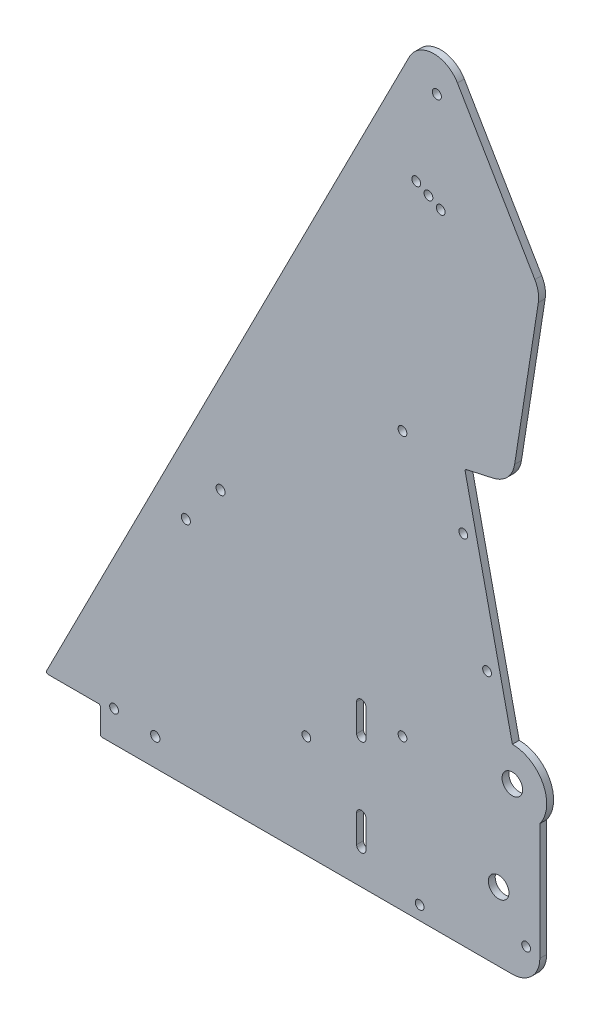
from build123d import *

# Parameters (mm, degrees)
BOSS_EXTRUDE1_DEPTH = 3.175
SKETCH2_R           = 2.0955
SKETCH2_R_2         = 2.032
SKETCH2_R_3         = 4.7625
CUT_EXTRUDE1_DEPTH  = 421.976111717
SKETCH7_R           = 2.159
CUT_EXTRUDE2_DEPTH  = 421.976111717
CUT_EXTRUDE3_REACH  = 422.976
SKETCH10_R          = 2.032
FILLET1_R           = 12.7
FILLET2_R           = 0.79375
SKETCH12_R          = 2.032
CUT_EXTRUDE5_DEPTH  = 410.593447353


with BuildPart() as part:
    # Sketch1 → Boss-Extrude1 (new body)
    with BuildSketch(Plane.XY):
        with BuildLine():
            Line((228.6, -12.7), (228.6, 53.975))
            ThreePointArc((228.6, 53.975), (230.099031657, 70.599515829), (215.9, 79.375))
            Line((215.9, 79.375), (193.909735224, 178.566674323))
            Line((193.909735224, 178.566674323), (215.607913982, 183.377044743))
            Line((215.607913982, 183.377044743), (228.6, 266.7))
            Line((228.6, 266.7), (178.754725958, 351.413083686))
            Line((178.754725958, 351.413083686), (0, 0))
            Line((0, 0), (25.4, 0))
            Line((25.4, 0), (25.4, -12.7))
            Line((25.4, -12.7), (228.6, -12.7))
        make_face()
    extrude(amount=BOSS_EXTRUDE1_DEPTH)

    # Sketch2 → Cut-Extrude1 (cut, through all)
    with BuildSketch(Plane.XY.offset(3.175)):
        with Locations((64.943150167, 94.057839899)):
            Circle(SKETCH2_R)
        with Locations((180.975, 322.164313376)):
            Circle(SKETCH2_R)
        with Locations((81.00705334, 113.73297687)):
            Circle(SKETCH2_R)
        with Locations((193.207821773, 152.394364194)):
            Circle(SKETCH2_R_2)
        with Locations((215.9, 63.5)):
            Circle(SKETCH2_R_3)
        with Locations((173.0375, -6.35)):
            Circle(SKETCH2_R_2)
        with Locations((204.202954161, 102.798527032)):
            Circle(SKETCH2_R_2)
        with Locations((209.55, 19.05)):
            Circle(SKETCH2_R_3)
        with Locations((165.1, 179.3875)):
            Circle(SKETCH2_R_2)
        with Locations((182.769678626, 276.816972924)):
            Circle(SKETCH2_R_2)
        with Locations((177.109839313, 279.695986462)):
            Circle(SKETCH2_R_2)
        with Locations((171.45, 282.575)):
            Circle(SKETCH2_R_2)
    extrude(amount=-CUT_EXTRUDE1_DEPTH, mode=Mode.SUBTRACT)

    # Sketch7 → Cut-Extrude2 (cut, through all)
    with BuildSketch(Plane.XY.offset(3.175)):
        with Locations((50.8, 0)):
            Circle(SKETCH7_R)
        with BuildLine():
            Line((143.891, 3.175), (143.891, 15.875))
            ThreePointArc((143.891, 15.875), (146.05, 18.034), (148.209, 15.875))
            Line((148.209, 15.875), (148.209, 3.175))
            ThreePointArc((148.209, 3.175), (146.05, 1.016), (143.891, 3.175))
        make_face()
        with BuildLine():
            Line((143.891, 47.625), (143.891, 60.325))
            ThreePointArc((143.891, 60.325), (146.05, 62.484), (148.209, 60.325))
            Line((148.209, 60.325), (148.209, 47.625))
            ThreePointArc((148.209, 47.625), (146.05, 45.466), (143.891, 47.625))
        make_face()
    extrude(amount=-CUT_EXTRUDE2_DEPTH, mode=Mode.SUBTRACT)

    # Sketch10 → Cut-Extrude3 (cut, up to next)
    with BuildSketch(Plane.XY.offset(3.175), mode=Mode.PRIVATE) as cut_extrude3_sk1:
        with Locations((165.1, 57.15)):
            Circle(SKETCH10_R)
    cut_extrude3_tool1 = extrude(cut_extrude3_sk1.sketch, amount=-CUT_EXTRUDE3_REACH, mode=Mode.PRIVATE) & part.part
    # Sketch10 → Cut-Extrude3 (cut, up to next)
    with BuildSketch(Plane.XY.offset(3.175), mode=Mode.PRIVATE) as cut_extrude3_sk2:
        with Locations((120.65, 34.925)):
            Circle(SKETCH10_R)
    cut_extrude3_tool2 = extrude(cut_extrude3_sk2.sketch, amount=-CUT_EXTRUDE3_REACH, mode=Mode.PRIVATE) & part.part
    add(cut_extrude3_tool1.solids().sort_by_distance((165.1, 57.15, 3.175))[0], mode=Mode.SUBTRACT)
    add(cut_extrude3_tool2.solids().sort_by_distance((120.65, 34.925, 3.175))[0], mode=Mode.SUBTRACT)

    # Fillet1
    fillet1_edges = [part.edges().sort_by_distance(p)[0] for p in [
        (228.6, -12.7, 1.5875),
        (178.754725958, 351.413083686, 1.5875),
        (215.607913982, 183.377044743, 1.5875),
        (228.6, 266.7, 1.5875),
    ]]
    fillet(fillet1_edges, radius=FILLET1_R)

    # Fillet2
    fillet2_edges = [part.edges().sort_by_distance(p)[0] for p in [
        (25.4, -12.7, 1.5875),
        (25.4, 0, 1.5875),
        (193.909735224, 178.566674323, 1.5875),
        (0, 0, 1.5875),
    ]]
    fillet(fillet2_edges, radius=FILLET2_R)

    # Sketch12 → Cut-Extrude5 (cut, through all)
    with BuildSketch(Plane.XY.offset(3.175)):
        with Locations((31.75, 1.5875)):
            Circle(SKETCH12_R)
        with Locations((222.25, 1.5875)):
            Circle(SKETCH12_R)
    extrude(amount=-CUT_EXTRUDE5_DEPTH, mode=Mode.SUBTRACT)


solid = part.part
